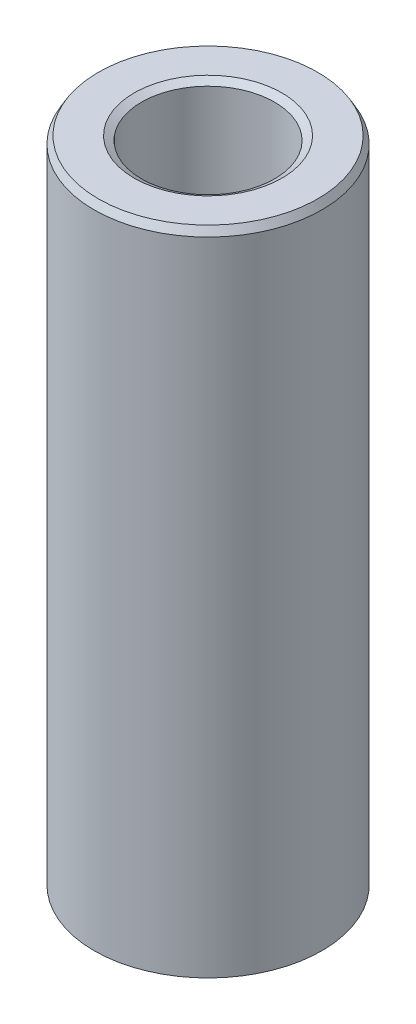
from build123d import *
from OCP.BRepFilletAPI import BRepFilletAPI_MakeChamfer

# Parameters (mm, degrees)
SKETCH1_R           = 30
BOSS_EXTRUDE1_DEPTH = 172.003541325
SKETCH2_R           = 17.51413468
CUT_EXTRUDE1_DEPTH  = 178.158737375
CHAMFER1_SIZE       = 1.945560997
CHAMFER1_SIZE2      = 1.123270165


with BuildPart() as part:
    # Sketch1 → Boss-Extrude1 (new body)
    with BuildSketch(Plane(origin=(0, 0, 0), x_dir=(1, 0, 0), z_dir=(0, 1, 0))):
        Circle(SKETCH1_R)
    extrude(amount=BOSS_EXTRUDE1_DEPTH)

    # Sketch2 → Cut-Extrude1 (cut, through all)
    with BuildSketch(Plane(origin=(0, 0, 0), x_dir=(1, 0, 0), z_dir=(0, 1, 0))):
        Circle(SKETCH2_R)
    extrude(amount=CUT_EXTRUDE1_DEPTH, mode=Mode.SUBTRACT)

    # Chamfer1: one chamfer whose edges measure the first distance from different faces: ONE call of the kernel's chamfer builder (chamfer() names one face for all edges)
    chamfer1_edges_1 = [part.edges().sort_by_distance(p)[0] for p in [
        (-17.51413468, 172.003541325, 0),
    ]]
    chamfer1_side_1 = [part.faces().sort_by_distance(p)[0] for p in [
        (-29.151471863, 172.003541325, 0),
    ]]
    chamfer1_edges_2 = [part.edges().sort_by_distance(p)[0] for p in [
        (-17.51413468, 0, 0),
    ]]
    chamfer1_side_2 = [part.faces().sort_by_distance(p)[0] for p in [
        (-17.51413468, 86.001770662, 0),
    ]]
    chamfer1_edges_3 = [part.edges().sort_by_distance(p)[0] for p in [
        (-30, 0, 0),
    ]]
    chamfer1_side_3 = [part.faces().sort_by_distance(p)[0] for p in [
        (-29.151471863, 0, 0),
    ]]
    chamfer1_edges_4 = [part.edges().sort_by_distance(p)[0] for p in [
        (-30, 172.003541325, 0),
    ]]
    chamfer1_side_4 = [part.faces().sort_by_distance(p)[0] for p in [
        (-30, 86.001770662, 0),
    ]]
    chamfer1 = BRepFilletAPI_MakeChamfer(part.part.solid().wrapped)
    for e in chamfer1_edges_1:
        chamfer1.Add(CHAMFER1_SIZE, CHAMFER1_SIZE2, e.wrapped, chamfer1_side_1[0].wrapped)  # the first distance lies on this face
    for e in chamfer1_edges_2:
        chamfer1.Add(CHAMFER1_SIZE, CHAMFER1_SIZE2, e.wrapped, chamfer1_side_2[0].wrapped)  # the first distance lies on this face
    for e in chamfer1_edges_3:
        chamfer1.Add(CHAMFER1_SIZE, CHAMFER1_SIZE2, e.wrapped, chamfer1_side_3[0].wrapped)  # the first distance lies on this face
    for e in chamfer1_edges_4:
        chamfer1.Add(CHAMFER1_SIZE, CHAMFER1_SIZE2, e.wrapped, chamfer1_side_4[0].wrapped)  # the first distance lies on this face
    add(Compound.cast(chamfer1.Shape()), mode=Mode.REPLACE)


solid = part.part
